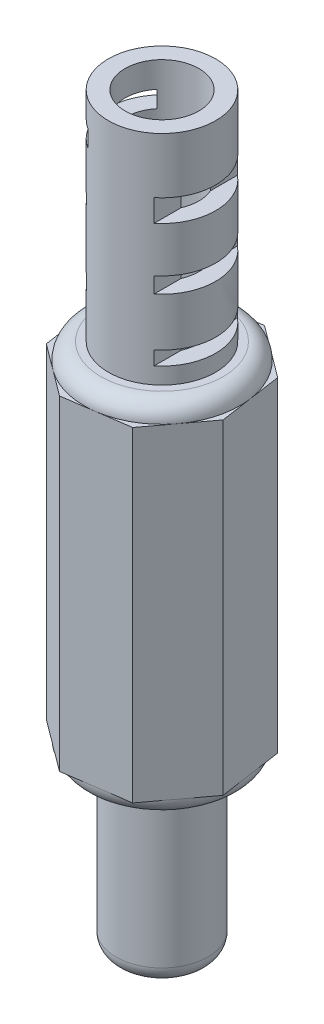
from build123d import *

# Parameters (mm, degrees)
FILLET_1_R               = 1
EXTRUDE_START            = -19.4
EXTRUDE_1_DEPTH          = 19.4
CUT_EXTRUDE_8_DEPTH      = 45.932997117
CUT_EXTRUDE_8_DEPTH_BACK = 45.932997117


with BuildPart() as part:
    # 草图1 → 旋转1 (revolve)
    with BuildSketch(Plane.XY, mode=Mode.PRIVATE) as revolve_1_sk:
        Polygon((2, 15), (2, 0), (2.75, 0), (2.75, 10), (4.65, 10), (4.65, 31.4), (3.2, 31.4), (3.2, 44.4), (2.2, 44.4), (2.2, 26.4), (2.65, 26.4), (2.65, 15), align=None)
    revolve(revolve_1_sk.sketch.rotate(Axis((0, -4.665178571, 0), (0, 1, 0)), 90), axis=Axis((0, -4.665178571, 0), (0, 1, 0)))

    # 圆角1
    # the kernel refuses this fillet: 1 mm, written as the material it takes off along each edge
    with BuildSketch(Plane(origin=(0, 31.4, 0), x_dir=(0, 0, -1), z_dir=(1, 0, 0))) as fillet_1_piece_1:
        with BuildLine():
            CenterArc((4.65 - FILLET_1_R, -FILLET_1_R), FILLET_1_R, 0, 90)
            Line((4.65 - FILLET_1_R, 0), (4.65 - FILLET_1_R, FILLET_1_R * 0.02))
            Line((4.65 - FILLET_1_R, FILLET_1_R * 0.02), (4.65 + FILLET_1_R * 0.02, FILLET_1_R * 0.02))
            Line((4.65 + FILLET_1_R * 0.02, FILLET_1_R * 0.02), (4.65 + FILLET_1_R * 0.02, -FILLET_1_R))
            Line((4.65 + FILLET_1_R * 0.02, -FILLET_1_R), (4.65, -FILLET_1_R))
        make_face()
    revolve(axis=Axis((0, 31.4, 0), (0, 1, 0)), mode=Mode.SUBTRACT)
    with BuildSketch(Plane(origin=(0, 10, 0), x_dir=(0, 0, -1), z_dir=(1, 0, 0))) as fillet_1_piece_2:
        with BuildLine():
            CenterArc((4.65 - FILLET_1_R, FILLET_1_R), FILLET_1_R, 270, 90)
            Line((4.65, FILLET_1_R), (4.65 + FILLET_1_R * 0.02, FILLET_1_R))
            Line((4.65 + FILLET_1_R * 0.02, FILLET_1_R), (4.65 + FILLET_1_R * 0.02, -FILLET_1_R * 0.02))
            Line((4.65 + FILLET_1_R * 0.02, -FILLET_1_R * 0.02), (4.65 - FILLET_1_R, -FILLET_1_R * 0.02))
            Line((4.65 - FILLET_1_R, -FILLET_1_R * 0.02), (4.65 - FILLET_1_R, 0))
        make_face()
    revolve(axis=Axis((0, 10, 0), (0, 1, 0)), mode=Mode.SUBTRACT)
    with BuildSketch(Plane(origin=(0, 0, 0), x_dir=(0, 0, -1), z_dir=(1, 0, 0))) as fillet_1_piece_3:
        with BuildLine():
            CenterArc((1.75, 0.968245837), FILLET_1_R, 284.477512186, 75.522487814)
            Line((2.75, 0.968245837), (2.77, 0.968245837))
            Line((2.77, 0.968245837), (2.77, 0))
            Line((2.77, 0), (2.75, -0.02))
            ThreePointArc((2.75, -0.02), (2.375, -0.02), (2.005, -0.019364917))
            Line((2.005, -0.019364917), (2, 0))
        make_face()
    revolve(axis=Axis((0, 0, 0), (0, 1, 0)), mode=Mode.SUBTRACT)

    # 草图2 → 凸台-拉伸1 (add)
    with BuildSketch(Plane(origin=(0, 30.4, 0), x_dir=(1, 0, 0), z_dir=(0, 1, 0)).offset(EXTRUDE_START)):
        with BuildLine():
            Line((2.779213221, 3.728065701), (1.234997781, 4.879253527))
            Line((1.234997781, 4.879253527), (-0.670940138, 4.601341036))
            ThreePointArc((-0.670940138, 4.601341036), (1.140989177, 4.507842466), (2.779213221, 3.728065701))
        make_face()
        with BuildLine():
            ThreePointArc((-3.728065726, 2.779213188), (-2.38072481, 3.99432715), (-0.670940138, 4.601341036))
            Line((-0.670940138, 4.601341036), (-2.57687795, 4.323428561))
            Line((-2.57687795, 4.323428561), (-3.728065726, 2.779213188))
        make_face()
        with BuildLine():
            Line((4.323428561, 2.57687795), (2.779213221, 3.728065701))
            ThreePointArc((2.779213221, 3.728065701), (3.994327171, 2.380724774), (4.601341042, 0.670940096))
            Line((4.601341042, 0.670940096), (4.323428561, 2.57687795))
        make_face()
        with BuildLine():
            ThreePointArc((-4.601341043, -0.67094009), (-4.507842465, 1.14098918), (-3.728065726, 2.779213188))
            Line((-3.728065726, 2.779213188), (-4.879253527, 1.234997781))
            Line((-4.879253527, 1.234997781), (-4.601341043, -0.67094009))
        make_face()
        with BuildLine():
            Line((4.879253527, -1.234997781), (4.601341042, 0.670940096))
            ThreePointArc((4.601341042, 0.670940096), (4.50784246, -1.1409892), (3.728065698, -2.779213226))
            Line((3.728065698, -2.779213226), (4.879253527, -1.234997781))
        make_face()
        with BuildLine():
            ThreePointArc((-2.779213228, -3.728065696), (-3.994327175, -2.380724768), (-4.601341043, -0.67094009))
            Line((-4.601341043, -0.67094009), (-4.323428561, -2.57687795))
            Line((-4.323428561, -2.57687795), (-2.779213228, -3.728065696))
        make_face()
        with BuildLine():
            ThreePointArc((0.670940034, -4.601341051), (-1.140989232, -4.507842452), (-2.779213228, -3.728065696))
            Line((-2.779213228, -3.728065696), (-1.234997781, -4.879253527))
            Line((-1.234997781, -4.879253527), (0.670940034, -4.601341051))
        make_face()
        with BuildLine():
            Line((2.57687795, -4.323428561), (3.728065698, -2.779213226))
            ThreePointArc((3.728065698, -2.779213226), (2.380724745, -3.994327189), (0.670940034, -4.601341051))
            Line((0.670940034, -4.601341051), (2.57687795, -4.323428561))
        make_face()
    extrude(amount=EXTRUDE_1_DEPTH)

    # 草图3 → 切除-拉伸8 (cut, two sides: drawn at the far end of the back side and taken through both)
    with BuildSketch(Plane.XY.offset(-CUT_EXTRUDE_8_DEPTH_BACK)):
        Polygon((-3.65, 42.874542092), (-3.65, 41.874542092), (-3.2, 41.874542092), (-1.7, 41.874542092), (-1.7, 42.874542092), (-3.2, 42.874542092), (-3.263750078, 42.874542092), align=None)
        Polygon((-3.65, 39.16171454), (-3.65, 38.513443063), (-3.2, 38.513443063), (-1.960187726, 38.513443063), (-1.960187726, 39.16171454), (-3.2, 39.16171454), align=None)
        Polygon((-3.65, 34.063943377), (-3.2, 34.063943377), (-1.960187726, 34.063943377), (-1.960187726, 35.006883708), (-3.2, 35.006883708), (-3.65, 35.006883708), align=None)
        Polygon((3.2, 36.097158465), (3.65, 36.097158465), (3.65, 37.040098796), (3.2, 37.040098796), (2.017841794, 37.040098796), (2.017841794, 36.097158465), align=None)
        Polygon((3.2, 39.751052247), (3.65, 39.751052247), (3.65, 41.077062087), (3.2, 41.077062087), (2.017841794, 41.077062087), (2.017841794, 39.751052247), align=None)
        Polygon((3.2, 32.384330913), (3.65, 32.384330913), (3.65, 33.209403702), (3.277688682, 33.209403702), (3.2, 33.209403702), (2.017841794, 33.209403702), (2.017841794, 32.384330913), align=None)
    extrude(amount=CUT_EXTRUDE_8_DEPTH + CUT_EXTRUDE_8_DEPTH_BACK, mode=Mode.SUBTRACT)


solid = part.part
